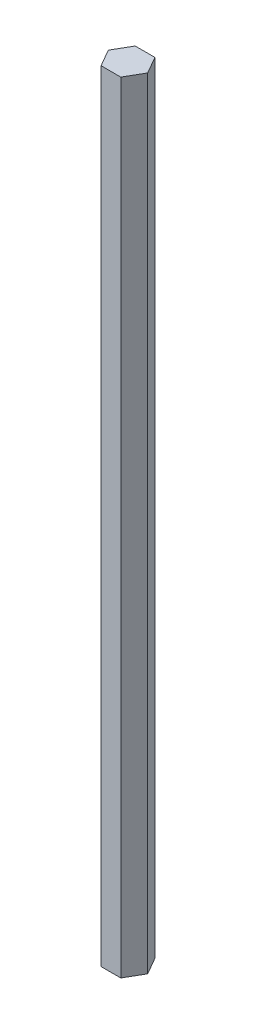
from build123d import *

# Parameters (mm, degrees)
BOSS_EXTRUDE1_DEPTH = 57.15


with BuildPart() as part:
    # Sketch1 → Boss-Extrude1 (new, symmetric)
    with BuildSketch(Plane(origin=(0, 0, 0), x_dir=(1, 0, 0), z_dir=(0, 1, 0))):
        Polygon((2.886751346, 0), (1.443375673, 2.5), (-1.443375673, 2.5), (-2.886751346, 0), (-1.443375673, -2.5), (1.443375673, -2.5), align=None)
    extrude(amount=BOSS_EXTRUDE1_DEPTH, both=True)


solid = part.part
